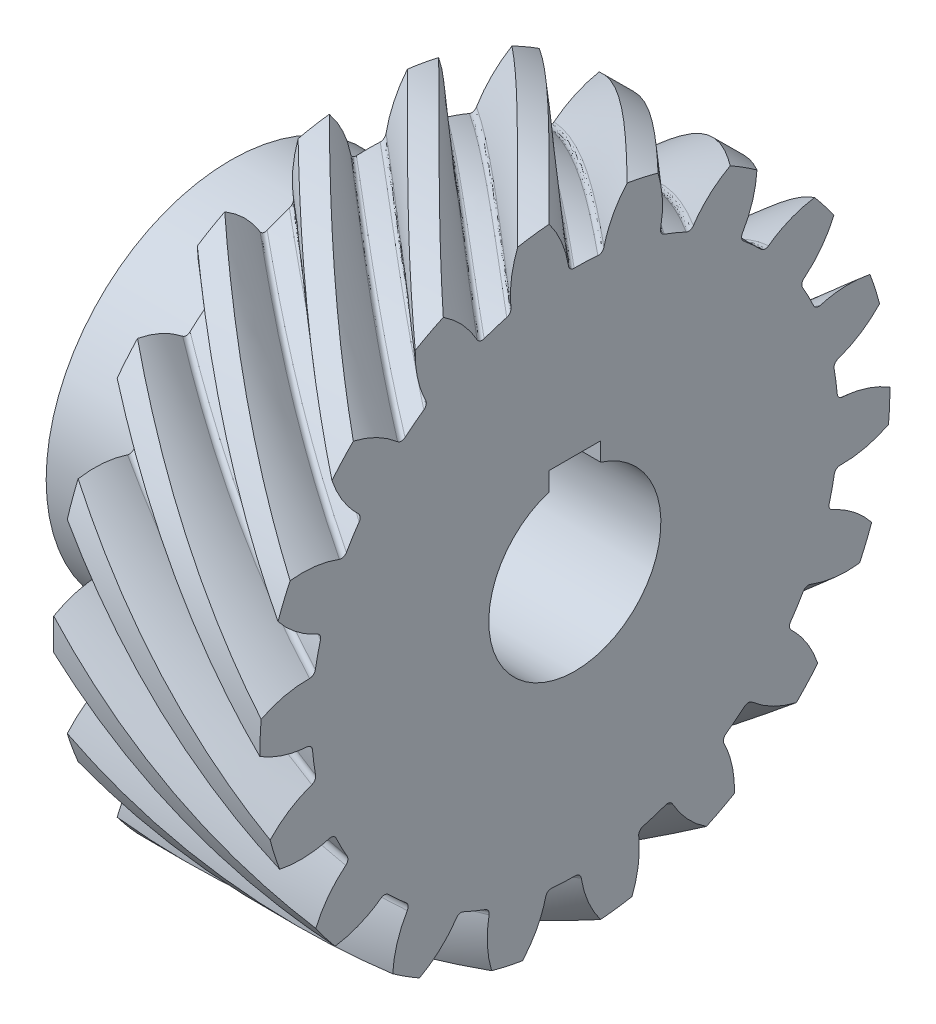
from build123d import *

# Parameters (mm, degrees)
BASPROSKE_W            = 19.05
BASPROSKE_H            = 29.05743503
TOOTHCUTRH_PITCH       = 182.573248844
TOOTHCUTRH_HEIGHT      = 19.05
TOOTHCUTRH_RADIUS      = 29.05743503
TOOTHCUTRH_START_ANGLE = -90
TEETHCUTSRH_COUNT      = 18
TEETHCUTSRH_ANGLE      = 340
HUBNEAONESKE_R         = 17.018
HUBNEARONE_DEPTH       = 12.7000508
BORSKE_R               = 7.9375
BORE_DEPTH             = 31.7500508
KEYSKE_W               = 4.7625
KEYSKE_H               = 9.2837
KEYWAY_DEPTH           = 31.7500508


with BuildPart() as part:
    # BasProSke → Base-Revolve (revolve)
    with BuildSketch(Plane(origin=(0, 0, 0), x_dir=(1, 0, 0), z_dir=(0, 1, 0)), mode=Mode.PRIVATE) as base_revolve_sk:
        with Locations((9.525, 14.528717515)):
            Rectangle(BASPROSKE_W, BASPROSKE_H)
    revolve(base_revolve_sk.sketch.rotate(Axis((-10, 0, 0), (1, 0, 0)), 180), axis=Axis((-10, 0, 0), (1, 0, 0)))

    # ToothCutRH: sweep along a helix
    with BuildLine() as toothcutrh_path:
        add(Helix(TOOTHCUTRH_PITCH, TOOTHCUTRH_HEIGHT, TOOTHCUTRH_RADIUS, center=(0, 0, 0), direction=(1, 0, 0), mode=Mode.PRIVATE).rotate(Axis((0, 0, 0), (1, 0, 0)), TOOTHCUTRH_START_ANGLE))
    # TooCutSkeRH → ToothCutRH (sweep, cut)
    with BuildSketch(Plane(origin=(0, 0, 0), x_dir=(0, 0, -1), z_dir=(1, 0, 0))):
        with BuildLine():
            ThreePointArc((1.09298271, 24.270336975), (0, 24.29493503), (-1.09298271, 24.270336975))
            ThreePointArc((-1.09298271, 24.270336975), (-1.443208168, 24.382084916), (-1.636674013, 24.694681207))
            ThreePointArc((-1.636674013, 24.694681207), (-2.607439026, 27.35703454), (-4.318513767, 29.615957561))
            ThreePointArc((-4.318513767, 29.615957561), (0, 29.929158081), (4.318513767, 29.615957561))
            ThreePointArc((4.318513767, 29.615957561), (2.607439026, 27.35703454), (1.636674013, 24.694681207))
            ThreePointArc((1.636674013, 24.694681207), (1.443208168, 24.382084916), (1.09298271, 24.270336975))
        make_face()
    toothcutrh = sweep(path=toothcutrh_path.line, is_frenet=True, mode=Mode.SUBTRACT)

    # TeethCutsRH: ToothCutRH ×18 about axis
    teethcutsrh_axis = Axis((-10, 0, 0), (1, 0, 0))
    for i in range(1, TEETHCUTSRH_COUNT):
        add(toothcutrh.rotate(teethcutsrh_axis, i * TEETHCUTSRH_ANGLE / (TEETHCUTSRH_COUNT - 1)), mode=Mode.SUBTRACT)

    # HubNeaOneSke → HubNearOne (add)
    with BuildSketch(Plane.ZY):
        with Locations(Location((0, 0, 0), (0, 0, 180))):
            Circle(HUBNEAONESKE_R)
    extrude(amount=HUBNEARONE_DEPTH)

    # BorSke → Bore (cut, symmetric)
    with BuildSketch(Plane(origin=(0, 0, 0), x_dir=(0, 0, -1), z_dir=(1, 0, 0))):
        with Locations(Location((0, 0, 0), (0, 0, 180))):
            Circle(BORSKE_R)
    extrude(amount=BORE_DEPTH, both=True, mode=Mode.SUBTRACT)

    # KeySke → Keyway (cut, symmetric)
    with BuildSketch(Plane(origin=(0, 0, 0), x_dir=(0, 0, -1), z_dir=(1, 0, 0))):
        with Locations((0, 4.64185)):
            Rectangle(KEYSKE_W, KEYSKE_H)
    extrude(amount=KEYWAY_DEPTH, both=True, mode=Mode.SUBTRACT)


solid = part.part
